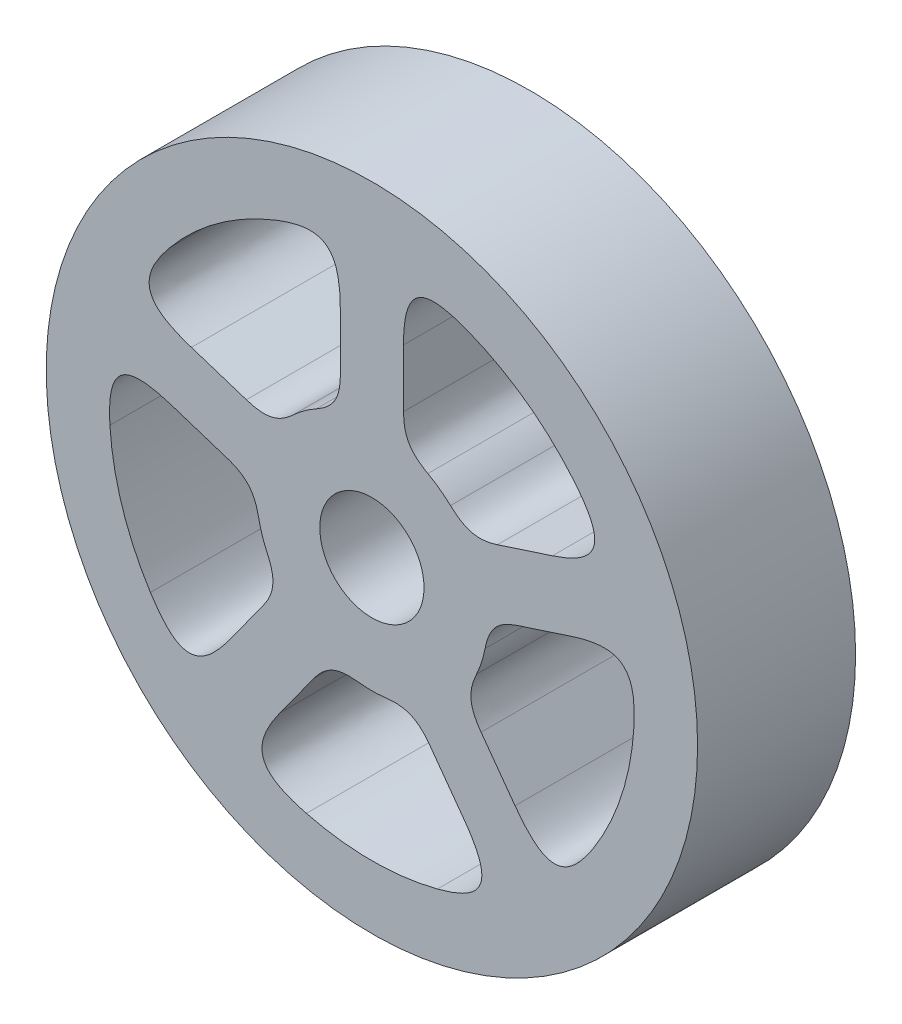
from build123d import *

# Parameters (mm, degrees)
SKETCH1_R           = 13.088900035
SKETCH1_R_2         = 2.0955
BOSS_EXTRUDE1_DEPTH = 6.35


with BuildPart() as part:
    # Sketch1 → Boss-Extrude1 (new body)
    with BuildSketch(Plane.XY):
        Circle(SKETCH1_R)
        Circle(SKETCH1_R_2, mode=Mode.SUBTRACT)
        with BuildLine():
            Line((1.27, 4.458134167), (1.27, 10.472172265))
            ThreePointArc((1.27, 10.472172265), (6.200487868, 8.5342394), (9.56717609, 4.443920974))
            Line((9.56717609, 4.443920974), (3.847485967, 2.585480996))
            ThreePointArc((3.847485967, 2.585480996), (2.724678537, 3.750198277), (1.27, 4.458134167))
        make_face(mode=Mode.SUBTRACT)
        with BuildLine():
            Line((-1.27, 4.458134167), (-1.27, 10.472172265))
            ThreePointArc((-1.27, 10.472172265), (-6.200487868, 8.5342394), (-9.56717609, 4.443920974))
            Line((-9.56717609, 4.443920974), (-3.847485967, 2.585480996))
            ThreePointArc((-3.847485967, 2.585480996), (-2.724678537, 3.750198277), (-1.27, 4.458134167))
        make_face(mode=Mode.SUBTRACT)
        with BuildLine():
            Line((4.632389133, 0.169797445), (10.352079255, 2.028237422))
            ThreePointArc((10.352079255, 2.028237422), (10.032600118, -3.259789383), (7.18284, -7.72567806))
            Line((7.18284, -7.72567806), (3.647877099, -2.860219034))
            ThreePointArc((3.647877099, -2.860219034), (4.408622481, -1.432448277), (4.632389133, 0.169797445))
        make_face(mode=Mode.SUBTRACT)
        with BuildLine():
            Line((1.592973933, -4.353193575), (5.127936834, -9.218652601))
            ThreePointArc((5.127936834, -9.218652601), (0, -10.548900035), (-5.127936834, -9.218652601))
            Line((-5.127936834, -9.218652601), (-1.592973933, -4.353193575))
            ThreePointArc((-1.592973933, -4.353193575), (0, -4.6355), (1.592973933, -4.353193575))
        make_face(mode=Mode.SUBTRACT)
        with BuildLine():
            Line((-3.647877099, -2.860219034), (-7.18284, -7.72567806))
            ThreePointArc((-7.18284, -7.72567806), (-10.032600118, -3.259789383), (-10.352079255, 2.028237422))
            Line((-10.352079255, 2.028237422), (-4.632389133, 0.169797445))
            ThreePointArc((-4.632389133, 0.169797445), (-4.408622481, -1.432448277), (-3.647877099, -2.860219034))
        make_face(mode=Mode.SUBTRACT)
    extrude(amount=BOSS_EXTRUDE1_DEPTH)

    # Fillet1
    # a fillet whose section is not a circle: 1.905 mm, written as the material it adds along each edge
    with BuildSketch(Plane(origin=(-3.647877099, -2.860219034, 0), x_dir=(-0.522930818064853, 0.8523751284018227, 0), z_dir=(0, 0, 1)), Plane(origin=(-3.847485967, 2.585480996, 0), x_dir=(0.6490624105300552, 0.7607351623508106, 0), z_dir=(0, 0, 1)), Plane(origin=(4.632389133, 0.169797445, 0), x_dir=(-0.0779536111986807, -0.9969569872873578, 0), z_dir=(0, 0, 1)), Plane(origin=(1.27, 4.458134167, 0), x_dir=(0.9240734485923511, -0.3822149416318515, 0), z_dir=(0, 0, 1))) as fillet1_piece_1:
        with BuildLine():
            Bezier((1.060784421, 0), (-0.053062648, 0.128288507), (-0.481606097, 1.164369463), weights=[1, 1.222222222, 1])
            Line((-0.481606097, 1.164369463), (0, 0))
            ThreePointArc((0, 0), (0.530392211, 0.03044361), (1.060784421, 0))
        make_face()
    extrude(amount=6.35)
    with BuildSketch(Plane(origin=(-4.632389133, 0.169797445, 0), x_dir=(-0.9510565162951501, 0.309016994374958, 0), z_dir=(0, 0, 1)), Plane(origin=(-1.592973933, -4.353193575, 0), x_dir=(-0.5877852522924732, -0.8090169943749472, 0), z_dir=(0, 0, 1)), Plane(origin=(3.647877099, -2.860219034, 0), x_dir=(0.5877852522924729, -0.8090169943749476, 0), z_dir=(0, 0, 1)), Plane(origin=(3.847485967, 2.585480996, 0), x_dir=(0.9510565162951545, 0.30901699437494495, 0), z_dir=(0, 0, 1))) as fillet1_piece_2:
        with BuildLine():
            Bezier((1.260039952, 0), (0.13882934, 0), (-0.405447656, 0.980242718), weights=[1, 1.222222222, 1])
            ThreePointArc((-0.405447656, 0.980242718), (-0.174591696, 0.501757362), (0, 0))
            Line((0, 0), (1.260039952, 0))
        make_face()
    extrude(amount=6.35)
    with BuildSketch(Plane(origin=(-10.352079255, 2.028237422, 0), x_dir=(0.9510565162951502, -0.3090169943749579, 0), z_dir=(0, 0, 1)), Plane(origin=(7.18284, -7.72567806, 0), x_dir=(-0.5877852522924735, 0.8090169943749472, 0), z_dir=(0, 0, 1)), Plane(origin=(9.56717609, 4.443920974, 0), x_dir=(-0.9510565162951543, -0.30901699437494506, 0), z_dir=(0, 0, 1))) as fillet1_piece_3:
        with BuildLine():
            Bezier((2.432496723, 0), (-0.367989994, 0), (0.660659723, -2.604727551), weights=[1, 1.222222222, 1])
            ThreePointArc((0.660659723, -2.604727551), (0.247050323, -1.32348669), (0, 0))
            Line((0, 0), (2.432496723, 0))
        make_face()
    extrude(amount=6.35)
    with BuildSketch(Plane(origin=(-7.18284, -7.72567806, 0), x_dir=(0.5877852522924731, 0.8090169943749476, 0), z_dir=(0, 0, 1)), Plane(origin=(5.127936834, -9.218652601, 0), x_dir=(-0.5877852522924732, 0.8090169943749473, 0), z_dir=(0, 0, 1)), Plane(origin=(10.352079255, 2.028237422, 0), x_dir=(-0.9510565162951544, -0.3090169943749445, 0), z_dir=(0, 0, 1)), Plane(origin=(1.27, 10.472172265, 0), x_dir=(0, -1, 0), z_dir=(0, 0, 1)), Plane(origin=(-9.56717609, 4.443920974, 0), x_dir=(0.95105651629515, -0.3090169943749585, 0), z_dir=(0, 0, 1))) as fillet1_piece_4:
        with BuildLine():
            Bezier((2.432496723, 0), (-0.367989994, 0), (0.660659723, 2.604727551), weights=[1, 1.222222222, 1])
            ThreePointArc((0.660659723, 2.604727551), (0.247050323, 1.32348669), (0, 0))
            Line((0, 0), (2.432496723, 0))
        make_face()
    extrude(amount=6.35)
    with BuildSketch(Plane(origin=(1.592973933, -4.353193575, 0), x_dir=(0.5877852522924731, -0.8090169943749475, 0), z_dir=(0, 0, 1))) as fillet1_piece_5:
        with BuildLine():
            Bezier((1.260039952, 0), (0.13882934, 0), (-0.405447656, -0.980242718), weights=[1, 1.222222222, 1])
            ThreePointArc((-0.405447656, -0.980242718), (-0.174591696, -0.501757362), (0, 0))
            Line((0, 0), (1.260039952, 0))
        make_face()
    extrude(amount=6.35)
    with BuildSketch(Plane(origin=(-5.127936834, -9.218652601, 0), x_dir=(0.9286949934866515, -0.37084445401384714, 0), z_dir=(0, 0, 1)), Plane(origin=(-1.27, 10.472172265, 0), x_dir=(-0.969306933285425, -0.2458537554824096, 0), z_dir=(0, 0, 1))) as fillet1_piece_6:
        with BuildLine():
            Bezier((2.687206148, 0), (-0.090471722, -0.356695253), (0.598038455, 2.357835939), weights=[1, 1.222222222, 1])
            Line((0.598038455, 2.357835939), (0, 0))
            ThreePointArc((0, 0), (1.343603074, -0.085916582), (2.687206148, 0))
        make_face()
    extrude(amount=6.35)
    with BuildSketch(Plane(origin=(-1.27, 4.458134167, 0), x_dir=(-0.9240734485923507, -0.38221494163185216, 0), z_dir=(0, 0, 1))) as fillet1_piece_7:
        with BuildLine():
            Bezier((1.060784421, 0), (-0.053062648, -0.128288507), (-0.481606097, -1.164369463), weights=[1, 1.222222222, 1])
            Line((-0.481606097, -1.164369463), (0, 0))
            ThreePointArc((0, 0), (0.530392211, -0.03044361), (1.060784421, 0))
        make_face()
    extrude(amount=6.35)


solid = part.part
